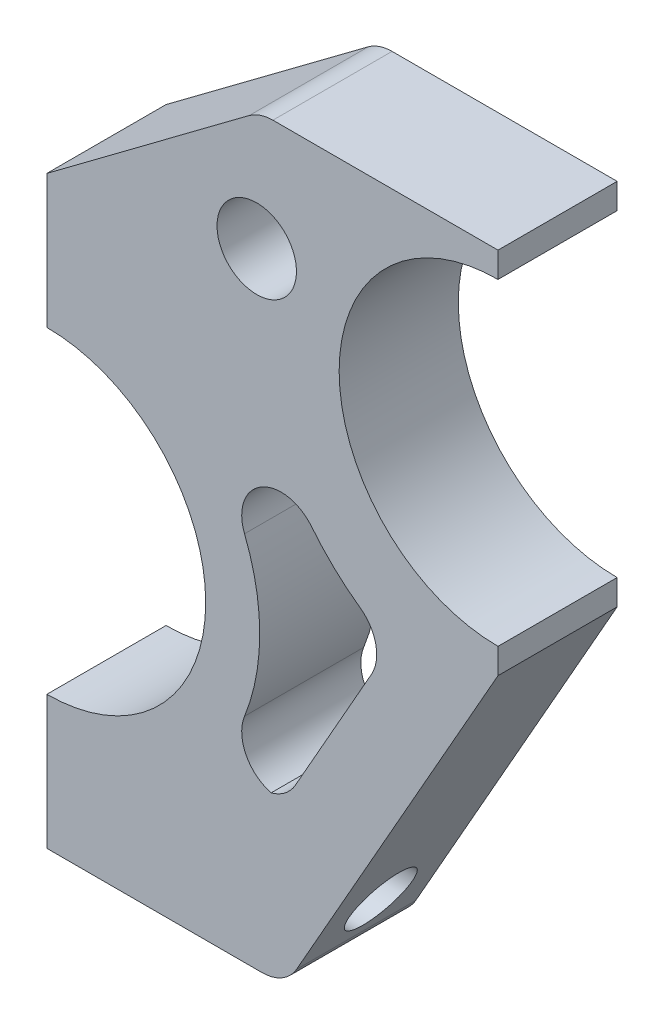
from build123d import *

# Parameters (mm, degrees)
SKETCH1_R           = 3.175
BOSS_EXTRUDE1_DEPTH = 9.525
SKETCH3_R           = 2.54
CUT_EXTRUDE1_DEPTH  = 12.7
CUT_EXTRUDE2_REACH  = 865.776
SKETCH4_R           = 2.54
FILLET1_R           = 3.175
SKETCH5_R           = 12.7
CUT_EXTRUDE3_DEPTH  = 881.013791313


with BuildPart() as part:
    # Sketch1 → Boss-Extrude1 (new body)
    with BuildSketch(Plane.XY):
        with BuildLine():
            Line((-169.8874175, 850.687119625), (-169.8874175, 837.987119625))
            ThreePointArc((-169.8874175, 837.987119625), (-159.2194175, 827.319119625), (-169.8874175, 816.651119625))
            Line((-169.8874175, 816.651119625), (-169.8874175, 803.951119625))
            Line((-169.8874175, 803.951119625), (-150.8374175, 803.951119625))
            Line((-150.8374175, 803.951119625), (-133.8194175, 833.943095553))
            Line((-133.8194175, 833.943095553), (-133.8194175, 835.975095553))
            ThreePointArc((-133.8194175, 835.975095553), (-146.5194175, 848.675095553), (-133.8194175, 861.375095553))
            Line((-133.8194175, 861.375095553), (-133.8194175, 863.407095553))
            Line((-133.8194175, 863.407095553), (-152.8694175, 863.407095553))
            Line((-152.8694175, 863.407095553), (-169.8874175, 850.687119625))
        make_face()
        with Locations(Location((-153.108454604, 853.862119625, 0), (0, 0, 180))):
            Circle(SKETCH1_R, mode=Mode.SUBTRACT)
        with BuildLine():
            Line((-150.93222253, 816.651119625), (-142.409287823, 831.671665669))
            ThreePointArc((-142.409287823, 831.671665669), (-146.401670459, 834.371620085), (-149.588680975, 837.987119625))
            Line((-149.588680975, 837.987119625), (-156.628228233, 837.987119625))
            ThreePointArc((-156.628228233, 837.987119625), (-152.8694175, 827.319119625), (-156.628228233, 816.651119625))
            Line((-156.628228233, 816.651119625), (-150.93222253, 816.651119625))
        make_face(mode=Mode.SUBTRACT)
    extrude(amount=BOSS_EXTRUDE1_DEPTH)

    # Sketch3 → Cut-Extrude1 (cut)
    with BuildSketch(Plane.ZY.offset(169.8874175)):
        with Locations((4.7625, 845.607119625)):
            Circle(SKETCH3_R)
        with Locations((4.7625, 809.031119625)):
            Circle(SKETCH3_R)
    extrude(amount=-CUT_EXTRUDE1_DEPTH, mode=Mode.SUBTRACT)

    # Sketch4 → Cut-Extrude2 (cut, up to next)
    with BuildSketch(Plane.ZY.offset(157.1874175), mode=Mode.PRIVATE) as cut_extrude2_sk1:
        with Locations((4.7625, 809.031119625)):
            Circle(SKETCH4_R)
    cut_extrude2_tool1 = extrude(cut_extrude2_sk1.sketch, amount=-CUT_EXTRUDE2_REACH, mode=Mode.PRIVATE) & part.part
    add(cut_extrude2_tool1.solids().sort_by_distance((-157.187417, 809.03112, 4.7625))[0], mode=Mode.SUBTRACT)

    # Fillet1
    # the kernel refuses this fillet: 3.175 mm, written as the material it adds along each edge
    with BuildSketch(Plane(origin=(-150.93222253, 816.651119625, 0), x_dir=(0.4935074111606293, 0.8697415910082337, 0), z_dir=(0, 0, 1))) as fillet1_piece_1:
        with BuildLine():
            CenterArc((FILLET1_R * 0.582348359646, FILLET1_R), FILLET1_R, 209.571375415, 60.428624585)
            Line((-FILLET1_R * 0.287393231362, FILLET1_R * 0.506492588839), (0, 0))
            Line((0, 0), (FILLET1_R * 0.582348359646, 0))
        make_face()
    extrude(amount=9.525)
    with BuildSketch(Plane(origin=(-149.588680975, 837.987119625, 0), x_dir=(0.5928517761937993, -0.8053115989875331, 0), z_dir=(0, 0, 1))) as fillet1_piece_2:
        with BuildLine():
            CenterArc((1.606983899, -3.172592716), FILLET1_R, 92.231294299, 51.409064566)
            Line((-0.949880428, -1.290288327), (0, 0))
            ThreePointArc((0, 0), (0.741684876, -0.014443703), (1.483369753, 0))
        make_face()
    extrude(amount=9.525)
    with BuildSketch(Plane(origin=(-156.628228233, 837.987119625, 0), x_dir=(1, 0, 0), z_dir=(0, 0, 1))) as fillet1_piece_3:
        with BuildLine():
            CenterArc((5.49213602, -3.175), FILLET1_R, 90, 111.781571646)
            ThreePointArc((2.543814434, -4.353144654), (1.434014336, -2.081843008), (0, 0))
            Line((0, 0), (5.49213602, 0))
        make_face()
    extrude(amount=9.525)
    with BuildSketch(Plane(origin=(-156.628228233, 816.651119625, 0), x_dir=(0.5045338460547648, 0.8633919145933595, 0), z_dir=(0, 0, 1))) as fillet1_piece_4:
        with BuildLine():
            CenterArc((5.512237838, -3.139970872), FILLET1_R, 98.518841269, 111.781571646)
            Line((2.770968509, -4.741865834), (0, 0))
            ThreePointArc((0, 0), (2.520955189, -0.187756124), (5.041910378, 0))
        make_face()
    extrude(amount=9.525)
    with BuildSketch(Plane(origin=(-142.409287823, 831.671665669, 0), x_dir=(-0.49350741116063396, -0.869741591008231, 0), z_dir=(0, 0, 1))) as fillet1_piece_5:
        with BuildLine():
            CenterArc((3.082586278, -3.175), FILLET1_R, 90, 84.177526613)
            ThreePointArc((-0.07603388, -2.852907312), (0.015483213, -1.427879508), (0, 0))
            Line((0, 0), (3.082586278, 0))
        make_face()
    extrude(amount=9.525)
    # the kernel refuses this fillet: 3.175 mm, written as the material it takes off along each edge
    with BuildSketch(Plane(origin=(-152.8694175, 863.407095553, -2.638608517), x_dir=(-0.80098222360548, -0.5986881303884525, 0), z_dir=(0, 0, 1))) as fillet1_2_piece_1:
        with BuildLine():
            CenterArc((FILLET1_R * 0.332423120307, FILLET1_R), FILLET1_R, 233.22400043, 36.77599957)
            Line((-FILLET1_R * 0.266265010081, FILLET1_R * 0.199017776395), (0, 0))
            Line((0, 0), (FILLET1_R * 0.332423120307, 0))
        make_face()
    extrude(amount=14.802217035, mode=Mode.SUBTRACT)
    with BuildSketch(Plane(origin=(-150.8374175, 803.951119625, -4.622390105), x_dir=(-1, 0, 0), z_dir=(0, 0, 1))) as fillet1_2_piece_2:
        with BuildLine():
            CenterArc((FILLET1_R * 0.582348359646, -FILLET1_R), FILLET1_R, 90, 60.428624585)
            Line((-FILLET1_R * 0.287393231362, -FILLET1_R * 0.506492588839), (0, 0))
            Line((0, 0), (FILLET1_R * 0.582348359646, 0))
        make_face()
    extrude(amount=18.769780209, mode=Mode.SUBTRACT)

    # Sketch5 → Cut-Extrude3 (cut, through all)
    with BuildSketch(Plane(origin=(0, 0, 0), x_dir=(-1, 0, 0), z_dir=(0, 0, -1))):
        with Locations((169.8874175, 827.319119625)):
            Circle(SKETCH5_R)
    extrude(amount=-CUT_EXTRUDE3_DEPTH, mode=Mode.SUBTRACT)


solid = part.part
